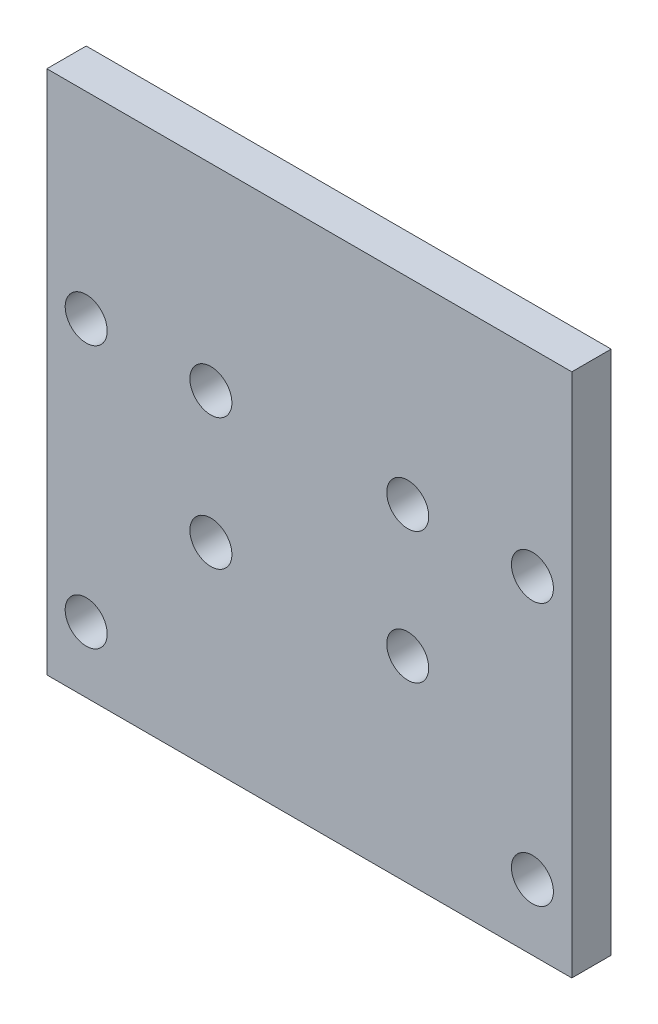
from build123d import *

# Parameters (mm, degrees)
SKETCH_1_W          = 40
SKETCH_1_H          = 40
EXTRUDE_1_DEPTH     = 3
SKETCH_2_R          = 1.6
CUT_EXTRUDE_1_DEPTH = 29.442925307


with BuildPart() as part:
    # 草图1 → 凸台-拉伸1 (new body)
    with BuildSketch(Plane.XY):
        Rectangle(SKETCH_1_W, SKETCH_1_H)
    extrude(amount=EXTRUDE_1_DEPTH)

    # 草图2 → 切除-拉伸1 (cut, through all)
    with BuildSketch(Plane.XY.offset(3)):
        with Locations((-7.5, 5)):
            Circle(SKETCH_2_R)
        with Locations((7.5, 5)):
            Circle(SKETCH_2_R)
        with Locations((7.5, -5)):
            Circle(SKETCH_2_R)
        with Locations((-7.5, -5)):
            Circle(SKETCH_2_R)
        with Locations((-17, -15)):
            Circle(SKETCH_2_R)
        with Locations((-17, 5)):
            Circle(SKETCH_2_R)
        with Locations((17, 5)):
            Circle(SKETCH_2_R)
        with Locations((17, -15)):
            Circle(SKETCH_2_R)
    extrude(amount=-CUT_EXTRUDE_1_DEPTH, mode=Mode.SUBTRACT)


solid = part.part
